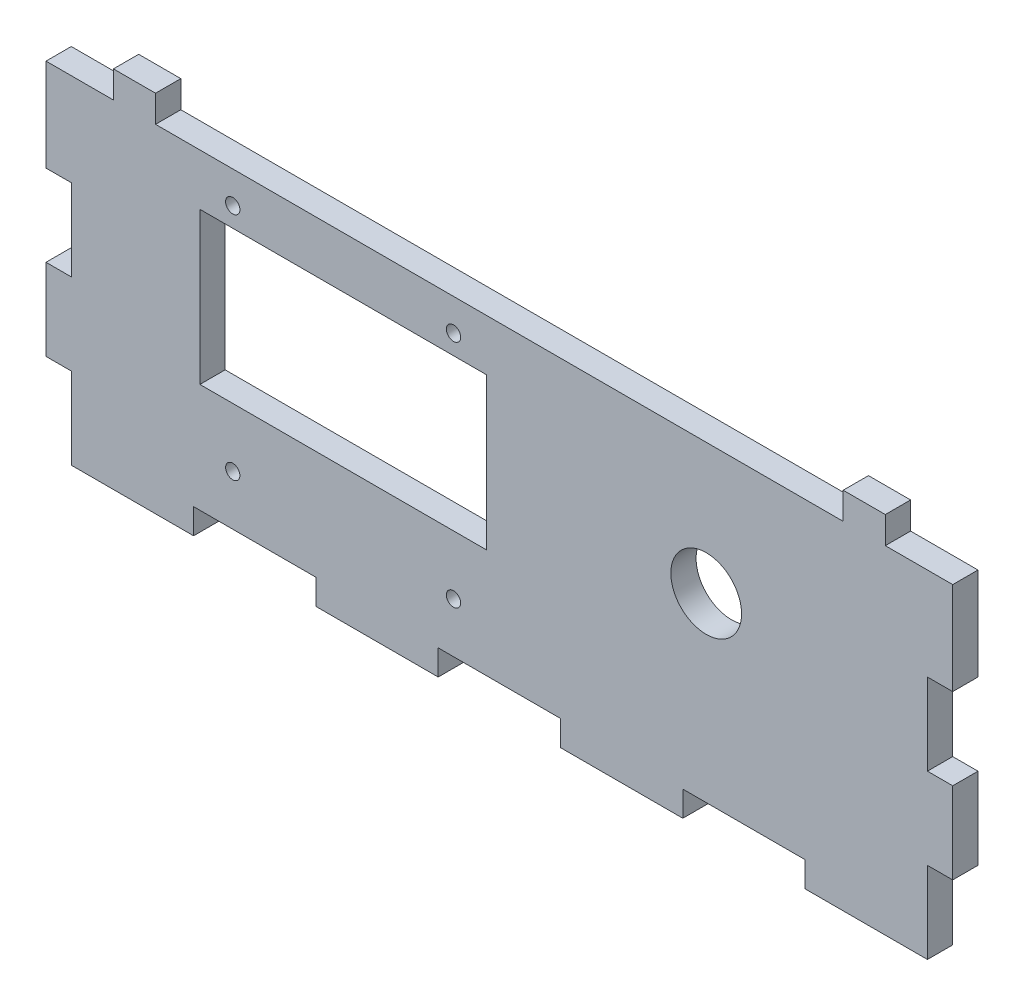
from build123d import *

# Parameters (mm, degrees)
CROQUIS1_R              = 0.85
CROQUIS1_W              = 34
CROQUIS1_H              = 18
CROQUIS1_R_2            = 4.2
SALIENTE_EXTRUIR1_DEPTH = 3


with BuildPart() as part:
    # Croquis1 → Saliente-Extruir1 (new body)
    with BuildSketch(Plane.XY):
        Polygon((-333.002689238, 38.183153475), (-318.486974952, 38.183153475), (-318.486974952, 47.861153475), (-315.486974952, 47.861153475), (-315.486974952, 57.539153475), (-318.486974952, 57.539153475), (-318.486974952, 67.217153475), (-315.486974952, 67.217153475), (-315.486974952, 78.217153475), (-318.486974952, 78.217153475), (-323.486974952, 78.217153475), (-323.486974952, 81.417153475), (-328.486974952, 81.417153475), (-328.486974952, 78.217153475), (-410.096974952, 78.217153475), (-410.096974952, 81.417153475), (-415.096974952, 81.417153475), (-415.096974952, 78.217153475), (-420.096974952, 78.217153475), (-423.096974952, 78.217153475), (-423.096974952, 67.217153475), (-420.096974952, 67.217153475), (-420.096974952, 57.539153475), (-423.096974952, 57.539153475), (-423.096974952, 47.861153475), (-420.096974952, 47.861153475), (-420.096974952, 38.183153475), (-405.581260666, 38.183153475), (-405.581260666, 41.183153475), (-391.06554638, 41.183153475), (-391.06554638, 38.183153475), (-376.549832095, 38.183153475), (-376.549832095, 41.183153475), (-362.034117809, 41.183153475), (-362.034117809, 38.183153475), (-347.518403523, 38.183153475), (-347.518403523, 41.183153475), (-333.002689238, 41.183153475), align=None)
        with Locations((-400.933395748, 47.11623137)):
            Circle(CROQUIS1_R, mode=Mode.SUBTRACT)
        with Locations((-374.733395748, 47.11623137)):
            Circle(CROQUIS1_R, mode=Mode.SUBTRACT)
        with Locations((-387.833395748, 63.11623137)):
            Rectangle(CROQUIS1_W, CROQUIS1_H, mode=Mode.SUBTRACT)
        with Locations((-400.933395748, 74.43623137)):
            Circle(CROQUIS1_R, mode=Mode.SUBTRACT)
        with Locations((-344.743963788, 62.671829043)):
            Circle(CROQUIS1_R_2, mode=Mode.SUBTRACT)
        with Locations((-374.733395748, 74.43623137)):
            Circle(CROQUIS1_R, mode=Mode.SUBTRACT)
    extrude(amount=SALIENTE_EXTRUIR1_DEPTH)


solid = part.part
